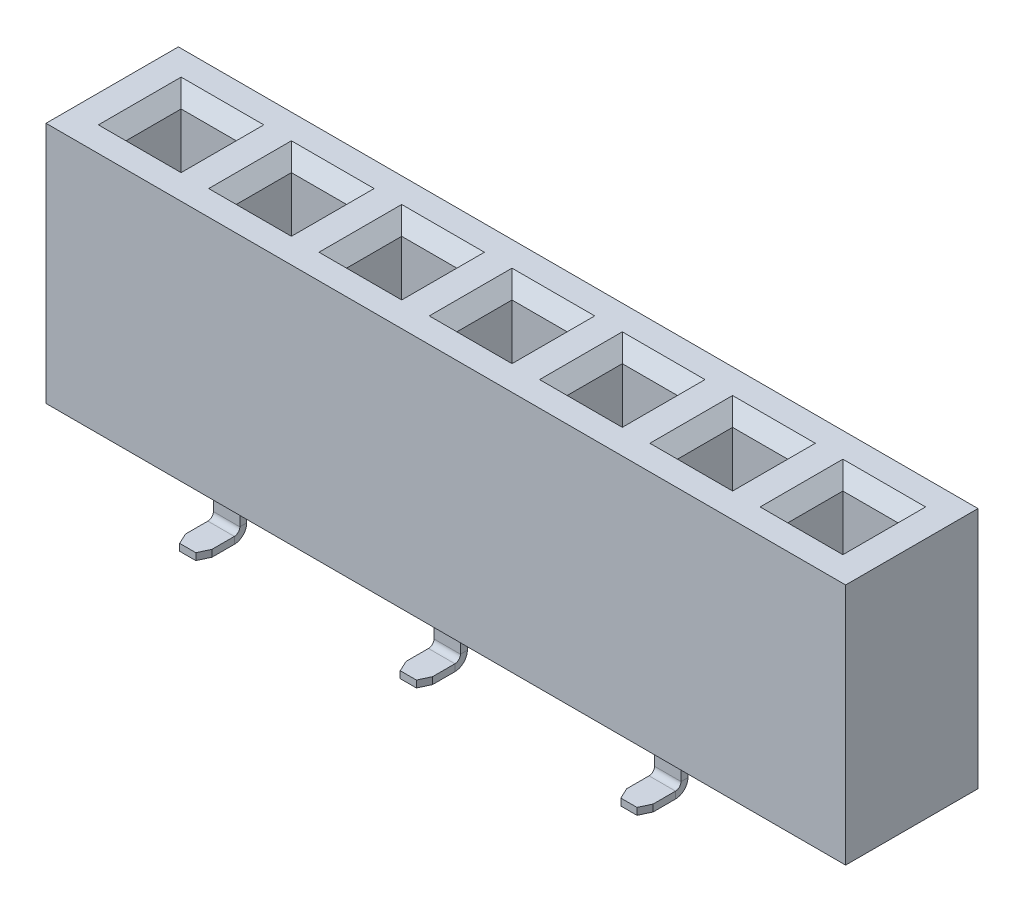
from build123d import *
from OCP.BRepFilletAPI import BRepFilletAPI_MakeChamfer

# Parameters (mm, degrees)
SKETCH1_W                  = 14.5
SKETCH1_H                  = 4.4
BOSS_EXTRUDE1_DEPTH        = 2.4
SKETCH2_W                  = 1
SKETCH2_H                  = 1
CUT_EXTRUDE1_DEPTH         = 2.5
CHAMFER1_SIZE              = 0.25
LPATTERN6_COUNT            = 7
LPATTERN6_PITCH            = 2
CHAMFER1_OF_LPATTERN6_SIZE = 0.25
BASE_FLANGE2_DEPTH         = 0.24
BASE_FLANGE2_DEPTH_BACK    = 0.24
BASE_FLANGE3_DEPTH         = 0.24
BASE_FLANGE3_DEPTH_BACK    = 0.24
CHAMFER3_SIZE              = 0.2
CHAMFER3_SIZE2             = 0.093261532
CHAMFER4_SIZE              = 0.2
CHAMFER4_SIZE2             = 0.093261532
LPATTERN4_COUNT            = 4
LPATTERN4_PITCH            = 4
LPATTERN3_COUNT            = 3
LPATTERN3_PITCH            = 4


# Sheet-metal steps are written as plain solids
with BuildPart() as part:
    # Sketch1 → Boss-Extrude1 (new body)
    with BuildSketch(Plane.XY):
        Rectangle(SKETCH1_W, SKETCH1_H)
    extrude(amount=BOSS_EXTRUDE1_DEPTH)

    # Sketch2 → Cut-Extrude1 (cut)
    with BuildSketch(Plane(origin=(0, 2.2, 0), x_dir=(1, 0, 0), z_dir=(0, 1, 0))):
        with Locations((-6, -1.2)):
            Rectangle(SKETCH2_W, SKETCH2_H)
    cut_extrude1 = extrude(amount=-CUT_EXTRUDE1_DEPTH, mode=Mode.SUBTRACT)

    # Chamfer1
    chamfer1_edges = [part.edges().sort_by_distance(p)[0] for p in [
        (-5.5, 2.2, 1.2),
        (-6, 2.2, 0.7),
        (-6.5, 2.2, 1.2),
        (-6, 2.2, 1.7),
    ]]
    chamfer(chamfer1_edges, length=CHAMFER1_SIZE)

    # LPattern6: Cut-Extrude1 ×7
    with Locations(*[(i * LPATTERN6_PITCH, 0, 0) for i in range(1, LPATTERN6_COUNT)]):
        add(cut_extrude1, mode=Mode.SUBTRACT)

    # Chamfer1 of LPattern6
    chamfer1_of_lpattern6_edges = [part.edges().sort_by_distance(p)[0] for p in [
        (-3.5, 2.2, 1.2),
        (-4, 2.2, 0.7),
        (-4.5, 2.2, 1.2),
        (-4, 2.2, 1.7),
        (-1.5, 2.2, 1.2),
        (-2, 2.2, 0.7),
        (-2.5, 2.2, 1.2),
        (-2, 2.2, 1.7),
        (0.5, 2.2, 1.2),
        (0, 2.2, 0.7),
        (-0.5, 2.2, 1.2),
        (0, 2.2, 1.7),
        (2.5, 2.2, 1.2),
        (2, 2.2, 0.7),
        (1.5, 2.2, 1.2),
        (2, 2.2, 1.7),
        (4.5, 2.2, 1.2),
        (4, 2.2, 0.7),
        (3.5, 2.2, 1.2),
        (4, 2.2, 1.7),
        (6.5, 2.2, 1.2),
        (6, 2.2, 0.7),
        (5.5, 2.2, 1.2),
        (6, 2.2, 1.7),
    ]]
    chamfer(chamfer1_of_lpattern6_edges, length=CHAMFER1_OF_LPATTERN6_SIZE)


with BuildPart() as body_2:
    # Sketch5 → Base-Flange2 (new, two sides: drawn at the far end of the back side and taken through both)
    with BuildSketch(Plane.ZY.offset(6).offset(-BASE_FLANGE2_DEPTH_BACK)):
        with BuildLine():
            Line((0.15, -2.2), (0.15, -2.405))
            ThreePointArc((0.15, -2.405), (0.084099026, -2.564099026), (-0.075, -2.63))
            Line((-0.075, -2.63), (-0.68, -2.63))
            Line((-0.68, -2.63), (-0.68, -2.505))
            Line((-0.68, -2.505), (-0.075, -2.505))
            ThreePointArc((-0.075, -2.505), (-0.004289322, -2.475710678), (0.025, -2.405))
            Line((0.025, -2.405), (0.025, -2.2))
            Line((0.025, -2.2), (0.15, -2.2))
        make_face()
    extrude(amount=BASE_FLANGE2_DEPTH + BASE_FLANGE2_DEPTH_BACK)

    # Chamfer4: one chamfer whose edges measure the first distance from different faces: ONE call of the kernel's chamfer builder (chamfer() names one face for all edges)
    chamfer4_edges_1 = [body_2.edges().sort_by_distance(p)[0] for p in [
        (-5.76, -2.5675, -0.68),
    ]]
    chamfer4_side_1 = [body_2.faces().sort_by_distance(p)[0] for p in [
        (-5.76, -2.3025, 0.034347727),
    ]]
    chamfer4_edges_2 = [body_2.edges().sort_by_distance(p)[0] for p in [
        (-6.24, -2.5675, -0.68),
    ]]
    chamfer4_side_2 = [body_2.faces().sort_by_distance(p)[0] for p in [
        (-6.24, -2.3025, 0.034347727),
    ]]
    chamfer4 = BRepFilletAPI_MakeChamfer(body_2.part.solid().wrapped)
    for e in chamfer4_edges_1:
        chamfer4.Add(CHAMFER4_SIZE, CHAMFER4_SIZE2, e.wrapped, chamfer4_side_1[0].wrapped)  # the first distance lies on this face
    for e in chamfer4_edges_2:
        chamfer4.Add(CHAMFER4_SIZE, CHAMFER4_SIZE2, e.wrapped, chamfer4_side_2[0].wrapped)  # the first distance lies on this face
    add(Compound.cast(chamfer4.Shape()), mode=Mode.REPLACE)


with BuildPart() as body_3:
    # Sketch22 → Base-Flange3 (new, two sides: drawn at the far end of the back side and taken through both)
    with BuildSketch(Plane.ZY.offset(4).offset(-BASE_FLANGE3_DEPTH_BACK)):
        with BuildLine():
            Line((2.25, -2.2), (2.25, -2.405))
            ThreePointArc((2.25, -2.405), (2.315900974, -2.564099026), (2.475, -2.63))
            Line((2.475, -2.63), (3.08, -2.63))
            Line((3.08, -2.63), (3.08, -2.505))
            Line((3.08, -2.505), (2.475, -2.505))
            ThreePointArc((2.475, -2.505), (2.404289322, -2.475710678), (2.375, -2.405))
            Line((2.375, -2.405), (2.375, -2.2))
            Line((2.375, -2.2), (2.25, -2.2))
        make_face()
    extrude(amount=BASE_FLANGE3_DEPTH + BASE_FLANGE3_DEPTH_BACK)

    # Chamfer3: one chamfer whose edges measure the first distance from different faces: ONE call of the kernel's chamfer builder (chamfer() names one face for all edges)
    chamfer3_edges_1 = [body_3.edges().sort_by_distance(p)[0] for p in [
        (-3.76, -2.5675, 3.08),
    ]]
    chamfer3_side_1 = [body_3.faces().sort_by_distance(p)[0] for p in [
        (-3.76, -2.3025, 2.365652273),
    ]]
    chamfer3_edges_2 = [body_3.edges().sort_by_distance(p)[0] for p in [
        (-4.24, -2.5675, 3.08),
    ]]
    chamfer3_side_2 = [body_3.faces().sort_by_distance(p)[0] for p in [
        (-4.24, -2.3025, 2.365652273),
    ]]
    chamfer3 = BRepFilletAPI_MakeChamfer(body_3.part.solid().wrapped)
    for e in chamfer3_edges_1:
        chamfer3.Add(CHAMFER3_SIZE, CHAMFER3_SIZE2, e.wrapped, chamfer3_side_1[0].wrapped)  # the first distance lies on this face
    for e in chamfer3_edges_2:
        chamfer3.Add(CHAMFER3_SIZE, CHAMFER3_SIZE2, e.wrapped, chamfer3_side_2[0].wrapped)  # the first distance lies on this face
    add(Compound.cast(chamfer3.Shape()), mode=Mode.REPLACE)


with BuildPart() as lpattern4_1:
    # LPattern4: pattern copy
    add(body_2.part.moved(Location(Vector(1, 0, 0) * (1 * LPATTERN4_PITCH))))


with BuildPart() as lpattern4_2:
    # LPattern4: pattern copy
    add(body_2.part.moved(Location(Vector(1, 0, 0) * (2 * LPATTERN4_PITCH))))


with BuildPart() as lpattern4_3:
    # LPattern4: pattern copy
    add(body_2.part.moved(Location(Vector(1, 0, 0) * (3 * LPATTERN4_PITCH))))


with BuildPart() as lpattern3_1:
    # LPattern3: pattern copy
    add(body_3.part.moved(Location(Vector(1, 0, 0) * (1 * LPATTERN3_PITCH))))


with BuildPart() as lpattern3_2:
    # LPattern3: pattern copy
    add(body_3.part.moved(Location(Vector(1, 0, 0) * (2 * LPATTERN3_PITCH))))


solid = Compound([part.part, body_2.part, body_3.part, lpattern4_1.part, lpattern4_2.part, lpattern4_3.part, lpattern3_1.part, lpattern3_2.part])
